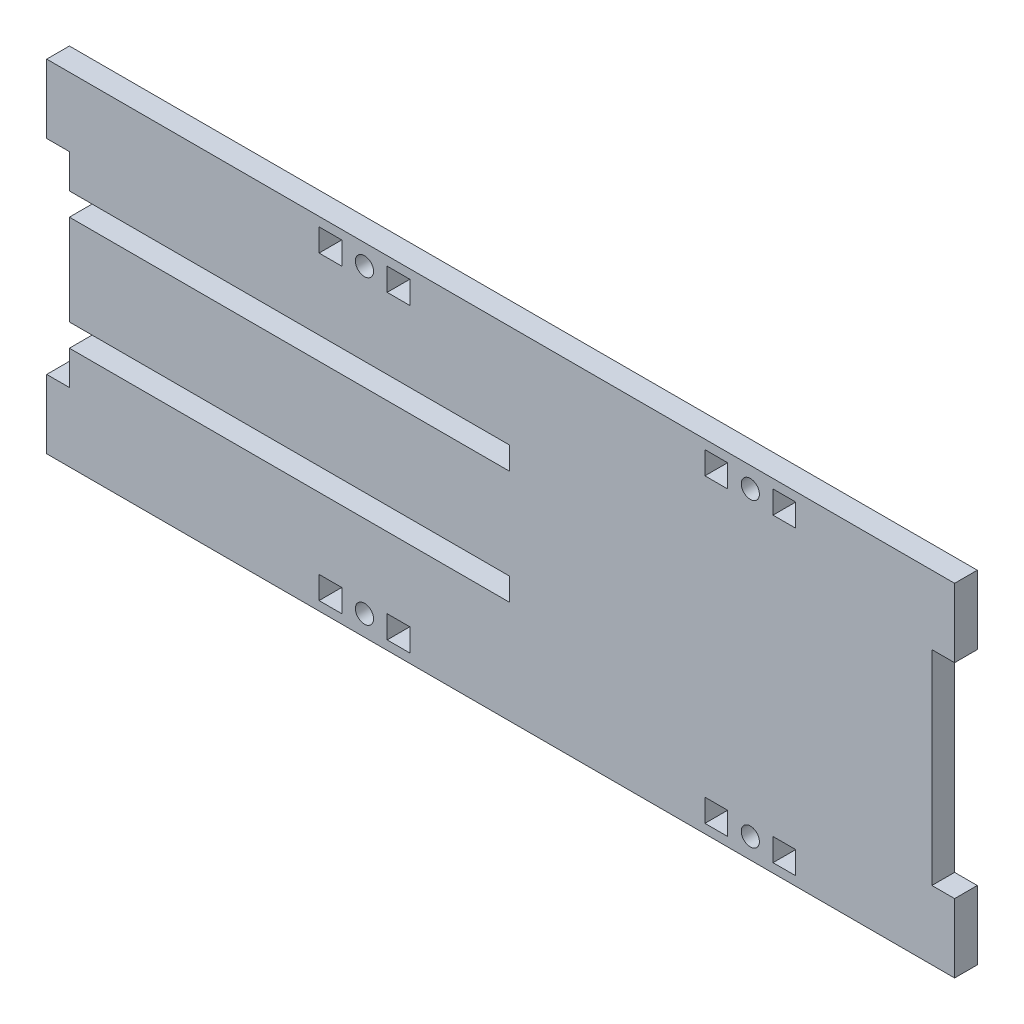
from build123d import *

# Parameters (mm, degrees)
ESQUISSE1_W        = 5
ESQUISSE1_H        = 5
ESQUISSE1_R        = 2
BOSS_EXTRU_1_DEPTH = 5


with BuildPart() as part:
    # Esquisse1 → Boss.-Extru.1 (new body)
    with BuildSketch(Plane.XY):
        Polygon((150, 37.65), (0, 37.65), (-50, 37.65), (-50, 22.5), (-45, 22.5), (-45, 15), (52, 15), (52, 10), (0, 10), (-45, 10), (-45, -10), (52, -10), (52, -15), (-45, -15), (-45, -22.5), (-50, -22.5), (-50, -37.65), (0, -37.65), (150, -37.65), (150, -22.5), (145, -22.5), (145, 22.5), (150, 22.5), align=None)
        with Locations((12.5, -33.15)):
            Rectangle(ESQUISSE1_W, ESQUISSE1_H, mode=Mode.SUBTRACT)
        with Locations((20, -33.15)):
            Circle(ESQUISSE1_R, mode=Mode.SUBTRACT)
        with Locations((27.5, -33.15)):
            Rectangle(ESQUISSE1_W, ESQUISSE1_H, mode=Mode.SUBTRACT)
        with Locations((97.5, -33.15)):
            Rectangle(ESQUISSE1_W, ESQUISSE1_H, mode=Mode.SUBTRACT)
        with Locations((105, -33.15)):
            Circle(ESQUISSE1_R, mode=Mode.SUBTRACT)
        with Locations((112.5, -33.15)):
            Rectangle(ESQUISSE1_W, ESQUISSE1_H, mode=Mode.SUBTRACT)
        with Locations((12.5, 33.15)):
            Rectangle(ESQUISSE1_W, ESQUISSE1_H, mode=Mode.SUBTRACT)
        with Locations((20, 33.15)):
            Circle(ESQUISSE1_R, mode=Mode.SUBTRACT)
        with Locations((27.5, 33.15)):
            Rectangle(ESQUISSE1_W, ESQUISSE1_H, mode=Mode.SUBTRACT)
        with Locations((97.5, 33.15)):
            Rectangle(ESQUISSE1_W, ESQUISSE1_H, mode=Mode.SUBTRACT)
        with Locations((105, 33.15)):
            Circle(ESQUISSE1_R, mode=Mode.SUBTRACT)
        with Locations((112.5, 33.15)):
            Rectangle(ESQUISSE1_W, ESQUISSE1_H, mode=Mode.SUBTRACT)
    extrude(amount=BOSS_EXTRU_1_DEPTH)


solid = part.part
